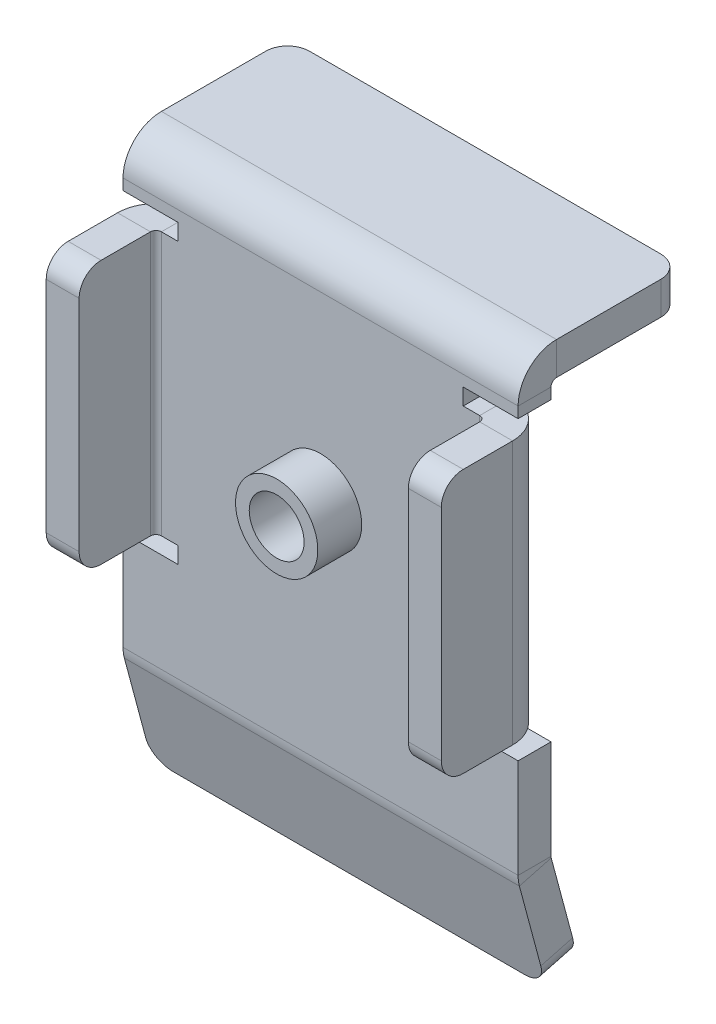
from build123d import *

# Parameters (mm, degrees)
SM_BASE_FLANGE_1_DEPTH            = 18
SM_EDGE_FLANGE_1_STRIP_W          = 13
SM_EDGE_FLANGE_1_STRIP_H          = 3
SM_EDGE_FLANGE_1_STRIP_CUT_DEPTH  = 24
SM_EDGE_FLANGE_1_RELIEF_W         = 14.5
SM_EDGE_FLANGE_1_RELIEF_H         = 1.5
SM_EDGE_FLANGE_1_RELIEF_CUT_DEPTH = 3
SM_EDGE_FLANGE_1_DEPTH            = 24
SM_EDGE_FLANGE_2_STRIP_W          = 13
SM_EDGE_FLANGE_2_STRIP_H          = 3
SM_EDGE_FLANGE_2_STRIP_CUT_DEPTH  = 24
SM_EDGE_FLANGE_2_RELIEF_W         = 14.5
SM_EDGE_FLANGE_2_RELIEF_H         = 1.5
SM_EDGE_FLANGE_2_RELIEF_CUT_DEPTH = 3
SM_EDGE_FLANGE_2_DEPTH            = 24
SKETCH_12_R                       = 3.75
EXTRUDE_1_DEPTH                   = 7
HOLE_WIZARD_M6_1_D                = 5
HOLE_WIZARD_M6_1_DEPTH            = 15
HOLE_WIZARD_M6_1_TIP              = 1.502151548
FILLET_1_R                        = 2


# Sheet-metal steps are written as plain solids
with BuildPart() as part:
    # 草图2 → 基体-法兰1 (new, symmetric)
    with BuildSketch(Plane(origin=(0, 0, 0), x_dir=(0, 0, -1), z_dir=(1, 0, 0))):
        with BuildLine():
            Line((2.588190451, -9.659258263), (0.119259608, -0.445082916))
            ThreePointArc((0.119259608, -0.445082916), (0.029942985, 0.003942069), (0, 0.460783742))
            Line((0, 0.460783742), (0, 37.5))
            ThreePointArc((0, 37.5), (1.025126266, 39.974873734), (3.5, 41))
            Line((3.5, 41), (15, 41))
            Line((15, 41), (15, 38))
            Line((15, 38), (3.5, 38))
            ThreePointArc((3.5, 38), (3.146446609, 37.853553391), (3, 37.5))
            Line((3, 37.5), (3, 0.460783742))
            ThreePointArc((3, 0.460783742), (3.004277569, 0.395520645), (3.017037087, 0.331374219))
            Line((3.017037087, 0.331374219), (5.48596793, -8.882801128))
            Line((5.48596793, -8.882801128), (2.588190451, -9.659258263))
        make_face()
    extrude(amount=SM_BASE_FLANGE_1_DEPTH, both=True)

    # 边线-法兰1 strip (across the edge) → 边线-法兰1 strip cut (cut)
    with BuildSketch(Plane(origin=(18, 11, 0), x_dir=(-1, 0, 0), z_dir=(0, 1, 0))):
        with Locations((-3, -1.5)):
            Rectangle(SM_EDGE_FLANGE_1_STRIP_W, SM_EDGE_FLANGE_1_STRIP_H)
    extrude(amount=SM_EDGE_FLANGE_1_STRIP_CUT_DEPTH, mode=Mode.SUBTRACT)

    # 边线-法兰1 relief (on the sheet) → 边线-法兰1 relief cut (cut)
    with BuildSketch(Plane(origin=(14.5, 11, 0), x_dir=(-1, 0, 0), z_dir=(0, 0, 1))):
        with Locations((-5.75, 0.75)):
            Rectangle(SM_EDGE_FLANGE_1_RELIEF_W, SM_EDGE_FLANGE_1_RELIEF_H)
        with Locations((-5.75, -24.75)):
            Rectangle(SM_EDGE_FLANGE_1_RELIEF_W, SM_EDGE_FLANGE_1_RELIEF_H)
    extrude(amount=-SM_EDGE_FLANGE_1_RELIEF_CUT_DEPTH, mode=Mode.SUBTRACT)

    # 边线-法兰1 section (across the edge) → 边线-法兰1 (add)
    with BuildSketch(Plane(origin=(18, 11, 0), x_dir=(-1, 0, 0), z_dir=(0, 1, 0))):
        with BuildLine():
            Line((0, 0.5), (0, 7))
            Line((0, 7), (3, 7))
            Line((3, 7), (3, 0.5))
            ThreePointArc((3, 0.5), (3.146446609, 0.146446609), (3.5, 0))
            Line((3.5, 0), (3.5, -3))
            ThreePointArc((3.5, -3), (1.025126266, -1.974873734), (0, 0.5))
        make_face()
    extrude(amount=SM_EDGE_FLANGE_1_DEPTH)

    # 边线-法兰2 strip (across the edge) → 边线-法兰2 strip cut (cut)
    with BuildSketch(Plane(origin=(-18, 35, 0), x_dir=(1, 0, 0), z_dir=(0, -1, 0))):
        with Locations((-3, -1.5)):
            Rectangle(SM_EDGE_FLANGE_2_STRIP_W, SM_EDGE_FLANGE_2_STRIP_H)
    extrude(amount=SM_EDGE_FLANGE_2_STRIP_CUT_DEPTH, mode=Mode.SUBTRACT)

    # 边线-法兰2 relief (on the sheet) → 边线-法兰2 relief cut (cut)
    with BuildSketch(Plane(origin=(-14.5, 35, 0), x_dir=(1, 0, 0), z_dir=(0, 0, 1))):
        with Locations((-5.75, 0.75)):
            Rectangle(SM_EDGE_FLANGE_2_RELIEF_W, SM_EDGE_FLANGE_2_RELIEF_H)
        with Locations((-5.75, -24.75)):
            Rectangle(SM_EDGE_FLANGE_2_RELIEF_W, SM_EDGE_FLANGE_2_RELIEF_H)
    extrude(amount=-SM_EDGE_FLANGE_2_RELIEF_CUT_DEPTH, mode=Mode.SUBTRACT)

    # 边线-法兰2 section (across the edge) → 边线-法兰2 (add)
    with BuildSketch(Plane(origin=(-18, 35, 0), x_dir=(1, 0, 0), z_dir=(0, -1, 0))):
        with BuildLine():
            Line((0, 0.5), (0, 7))
            Line((0, 7), (3, 7))
            Line((3, 7), (3, 0.5))
            ThreePointArc((3, 0.5), (3.146446609, 0.146446609), (3.5, 0))
            Line((3.5, 0), (3.5, -3))
            ThreePointArc((3.5, -3), (1.025126266, -1.974873734), (0, 0.5))
        make_face()
    extrude(amount=SM_EDGE_FLANGE_2_DEPTH)

    # 草图12 → 凸台-拉伸1 (add)
    with BuildSketch(Plane(origin=(0, 0, -3), x_dir=(-1, 0, 0), z_dir=(0, 0, -1))):
        with Locations((0, 21)):
            Circle(SKETCH_12_R)
    extrude(amount=-EXTRUDE_1_DEPTH)

    # M6 螺纹孔1
    with Locations(Plane(origin=(0, 0, -3), x_dir=(-1, 0, 0), z_dir=(0, 0, -1))):
        with Locations((0, 21)):
            Hole(HOLE_WIZARD_M6_1_D / 2, depth=HOLE_WIZARD_M6_1_DEPTH)
            with Locations((0, 0, -(HOLE_WIZARD_M6_1_DEPTH + HOLE_WIZARD_M6_1_TIP / 2))):  # 118° drill point
                Cone(0, HOLE_WIZARD_M6_1_D / 2, HOLE_WIZARD_M6_1_TIP, mode=Mode.SUBTRACT)

    # 圆角1
    fillet_1_edges = [part.edges().sort_by_distance(p)[0] for p in [
        (-18, -9.271029695, -4.03707919),
        (-16.5, 35, 7),
        (-16.5, 11, 7),
        (-18, 39.5, -15),
        (18, -9.271029695, -4.03707919),
        (18, 39.5, -15),
        (16.5, 11, 7),
        (16.5, 35, 7),
    ]]
    fillet(fillet_1_edges, radius=FILLET_1_R)


solid = part.part
